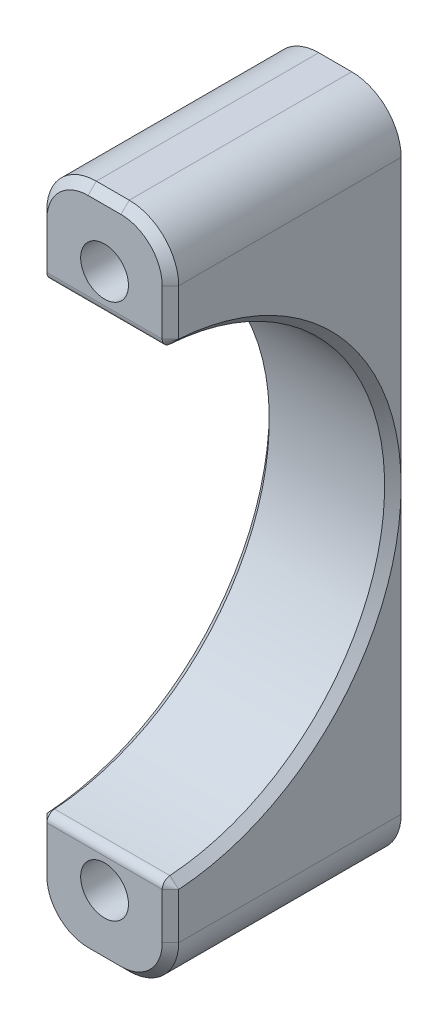
from build123d import *

# Parameters (mm, degrees)
SKETCH_1_R               = 1.45
EXTRUDE_1_DEPTH          = 14
CUT_EXTRUDE_1_DEPTH      = 26.896554891
CUT_EXTRUDE_1_DEPTH_BACK = 26.896554891
SKETCH_2_R               = 14
FILLET_1_R               = 0.5
CHAMFER_1_SIZE           = 0.5


with BuildPart() as part:
    # 草图1 → 凸台-拉伸1 (new body)
    with BuildSketch(Plane.XY):
        with BuildLine():
            Line((151.264880132, 20.264045876), (153.264880132, 20.264045876))
            ThreePointArc((153.264880132, 20.264045876), (155.386200475, 19.385366219), (156.264880132, 17.264045876))
            Line((156.264880132, 17.264045876), (156.264880132, -17.264045876))
            ThreePointArc((156.264880132, -17.264045876), (155.386200475, -19.385366219), (153.264880132, -20.264045876))
            Line((153.264880132, -20.264045876), (151.264880132, -20.264045876))
            ThreePointArc((151.264880132, -20.264045876), (149.143559788, -19.385366219), (148.264880132, -17.264045876))
            Line((148.264880132, -17.264045876), (148.264880132, 17.264045876))
            ThreePointArc((148.264880132, 17.264045876), (149.143559788, 19.385366219), (151.264880132, 20.264045876))
        make_face()
        with Locations((152.264880132, 16.264045876)):
            Circle(SKETCH_1_R, mode=Mode.SUBTRACT)
        with Locations((152.264880132, -16.264045876)):
            Circle(SKETCH_1_R, mode=Mode.SUBTRACT)
    extrude(amount=EXTRUDE_1_DEPTH)

    # 草图2 → 切除-拉伸1 (cut, two sides: drawn at the far end of the back side and taken through both)
    with BuildSketch(Plane.ZY.offset(-148.264880132).offset(-CUT_EXTRUDE_1_DEPTH_BACK)):
        with Locations((14.5, 0)):
            Circle(SKETCH_2_R)
    extrude(amount=CUT_EXTRUDE_1_DEPTH + CUT_EXTRUDE_1_DEPTH_BACK, mode=Mode.SUBTRACT)

    # 圆角1
    fillet_1_edges = [part.edges().sort_by_distance(p)[0] for p in [
        (152.264880132, 13.99106858, 14),
        (152.264880132, -13.99106858, 14),
    ]]
    fillet(fillet_1_edges, radius=FILLET_1_R)

    # 倒角1
    chamfer_1_edges = [part.edges().sort_by_distance(p)[0] for p in [
        (155.386200475, 19.385366219, 14),
        (152.264880132, 20.264045876, 14),
        (149.143559788, 19.385366219, 14),
        (148.264880132, 15.864761009, 14),
        (149.143559788, -19.385366219, 14),
        (152.264880132, -20.264045876, 14),
        (148.264880132, 0, 0.5),
        (156.264880132, 0, 0.5),
        (156.264880132, 15.864761009, 14),
        (156.264880132, 14.124332022, 13.865541639),
        (156.264880132, -14.124332022, 13.865541639),
        (148.264880132, -15.864761009, 14),
        (148.264880132, 14.124332022, 13.865541639),
        (148.264880132, -14.124332022, 13.865541639),
        (155.386200475, -19.385366219, 14),
        (156.264880132, -15.864761009, 14),
    ]]
    chamfer(chamfer_1_edges, length=CHAMFER_1_SIZE - 0.0001)  # a hair under: the kernel refuses the full size


solid = part.part
